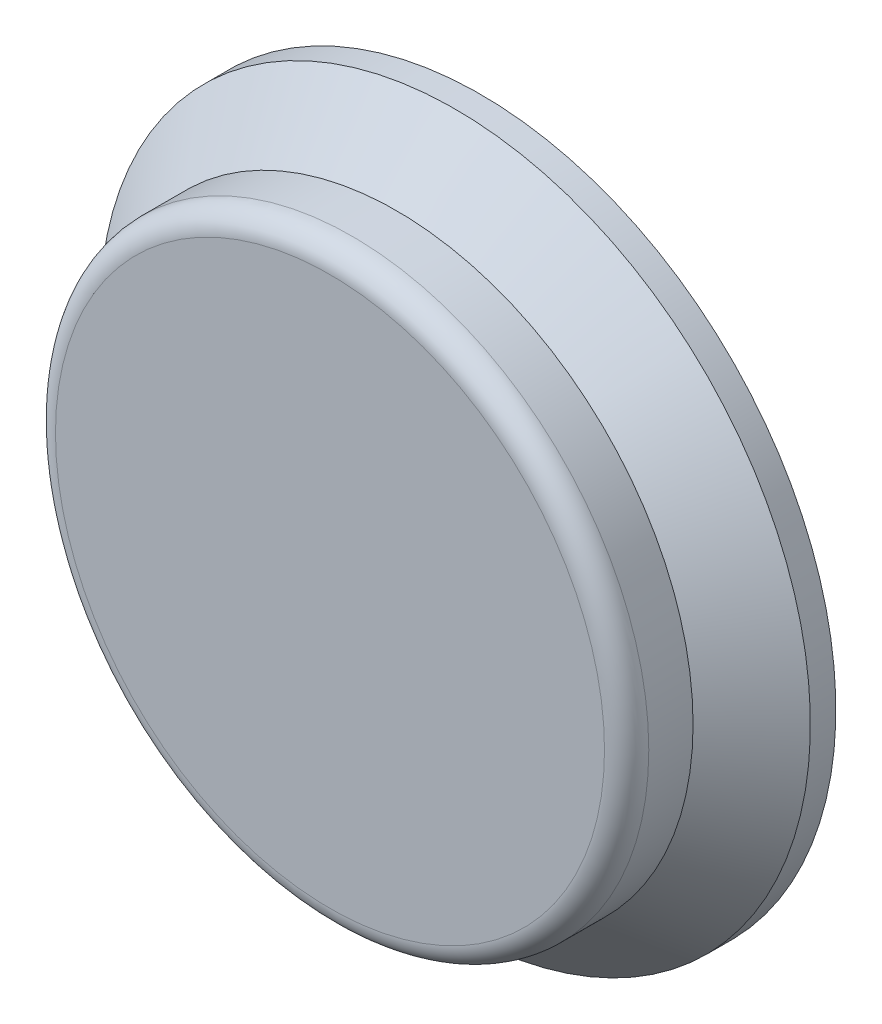
from build123d import *

# Parameters (mm, degrees)
SCHIZZO1_R                   = 16.05
ESTRUSIONE_ESTRUSIONE1_DEPTH = 3.8
SCHIZZO2_R                   = 13.4
ESTRUSIONE_ESTRUSIONE2_DEPTH = 3
SMUSSO1_SIZE                 = 2.65
RACCORDO1_R                  = 1
SCHIZZO3_R                   = 13.25
TAGLIO_ESTRUSIONE1_DEPTH     = 5
SMUSSO2_SIZE                 = 1.5


with BuildPart() as part:
    # Schizzo1 → Estrusione-Estrusione1 (new body)
    with BuildSketch(Plane.XY):
        with Locations(Location((0, 0, 0), (0, 0, 180))):
            Circle(SCHIZZO1_R)
    extrude(amount=ESTRUSIONE_ESTRUSIONE1_DEPTH)

    # Schizzo2 → Estrusione-Estrusione2 (add)
    with BuildSketch(Plane.XY.offset(3.8)):
        Circle(SCHIZZO2_R)
    extrude(amount=ESTRUSIONE_ESTRUSIONE2_DEPTH)

    # Smusso1
    smusso1_edges = [part.edges().sort_by_distance(p)[0] for p in [
        (16.05, 0, 3.8),
    ]]
    chamfer(smusso1_edges, length=SMUSSO1_SIZE - 0.0001)  # a hair under: the kernel refuses the full size

    # Raccordo1
    raccordo1_edges = [part.edges().sort_by_distance(p)[0] for p in [
        (-13.4, 0, 6.8),
    ]]
    fillet(raccordo1_edges, radius=RACCORDO1_R)

    # Schizzo3 → Taglio-Estrusione1 (cut)
    with BuildSketch(Plane(origin=(0, 0, 0), x_dir=(-1, 0, 0), z_dir=(0, 0, -1))):
        Circle(SCHIZZO3_R)
    extrude(amount=-TAGLIO_ESTRUSIONE1_DEPTH, mode=Mode.SUBTRACT)

    # Smusso2
    smusso2_edges = [part.edges().sort_by_distance(p)[0] for p in [
        (13.25, 0, 0),
    ]]
    chamfer(smusso2_edges, length=SMUSSO2_SIZE)


solid = part.part
